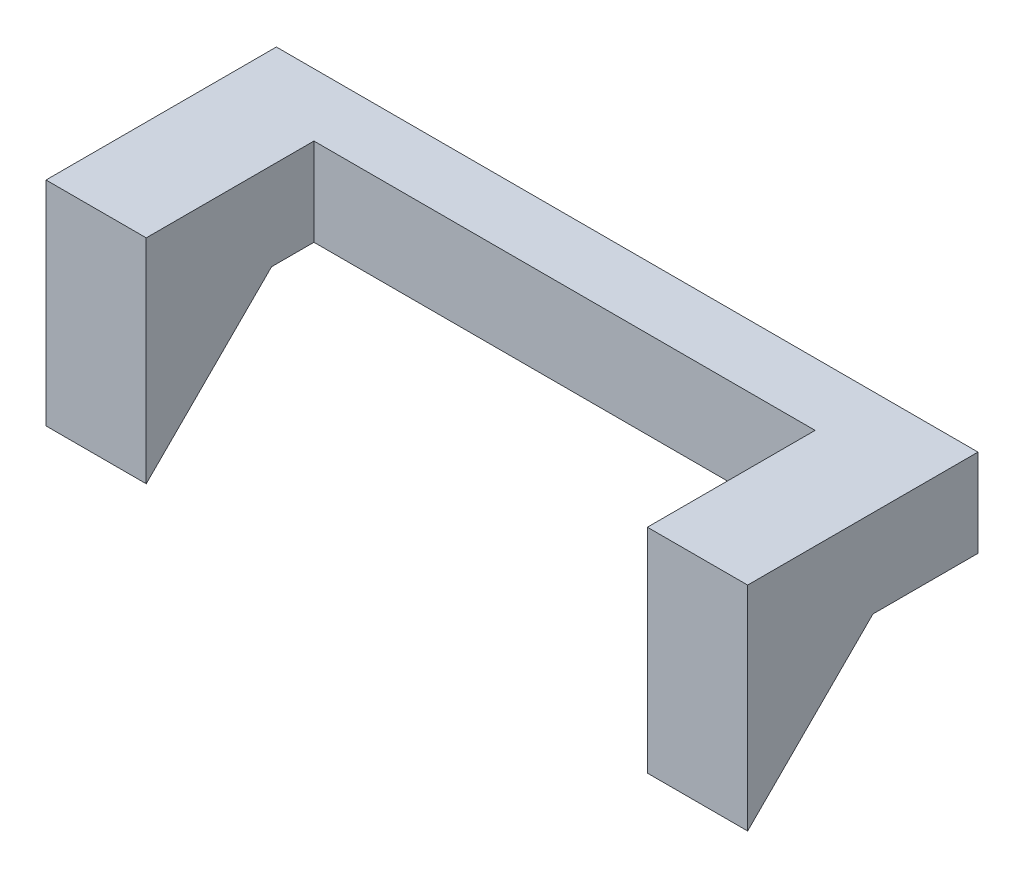
from build123d import *

# Parameters (mm, degrees)
SKETCH1_W           = 71.12
SKETCH1_H           = 8.89
BOSS_EXTRUDE1_DEPTH = 6.35
SKETCH5_W           = 10.16
SKETCH5_H           = 8.89
BOSS_EXTRUDE5_DEPTH = 17
SKETCH6_W           = 10.16
SKETCH6_H           = 12.7
BOSS_EXTRUDE6_DEPTH = 12.7
CHAMFER3_SIZE       = 12.7


with BuildPart() as part:
    # Sketch1 → Boss-Extrude1 (new body)
    with BuildSketch(Plane.XY):
        with Locations((142.501032585, 60.698661386)):
            Rectangle(SKETCH1_W, SKETCH1_H)
    extrude(amount=BOSS_EXTRUDE1_DEPTH)

    # Sketch5 → Boss-Extrude5 (add)
    with BuildSketch(Plane.XY.offset(6.35)):
        with Locations((112.021032585, 60.698661386)):
            Rectangle(SKETCH5_W, SKETCH5_H)
        with Locations((172.981032585, 60.698661386)):
            Rectangle(SKETCH5_W, SKETCH5_H)
    extrude(amount=BOSS_EXTRUDE5_DEPTH)

    # Sketch6 → Boss-Extrude6 (add)
    with BuildSketch(Plane.XZ.offset(-56.253661386)):
        with Locations((172.981032585, 17)):
            Rectangle(SKETCH6_W, SKETCH6_H)
        with Locations((112.021032585, 17)):
            Rectangle(SKETCH6_W, SKETCH6_H)
    extrude(amount=BOSS_EXTRUDE6_DEPTH)

    # Chamfer3
    chamfer3_edges = [part.edges().sort_by_distance(p)[0] for p in [
        (112.021032585, 43.553661386, 10.65),
        (172.981032585, 43.553661386, 10.65),
    ]]
    chamfer(chamfer3_edges, length=CHAMFER3_SIZE - 0.0001)  # a hair under: the kernel refuses the full size


solid = part.part
